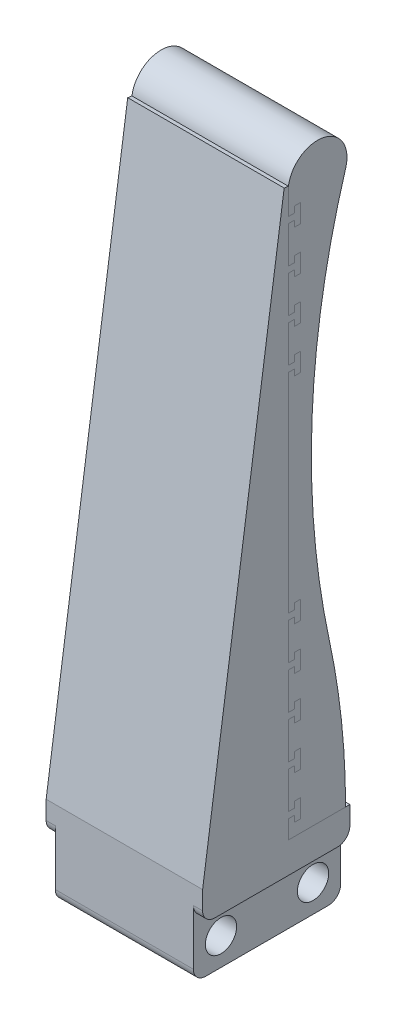
from build123d import *

# Parameters (mm, degrees)
THUMB_BASE_START        = -11.25
THUMB_BASE_OUTLINE_R    = 2.55
THUMB_BASE_DEPTH        = 22.5
THUMB_BASE_START_2      = -12.75
THUMB_BASE_2_DEPTH      = 25.5
THUMB_FRAME_DEPTH       = 25.5
CAVITY_PAD_DEPTH        = 115.636626674
PAD_HOOKS_DEPTH         = 25.5
SKETCH6_W               = 2.787046331
SKETCH6_H               = 25.802107577
CLEARANCE_PAD_CUT_DEPTH = 115.636626674
PAD_MATERIAL_DEPTH      = 25.5
WALL_REMOVAL_DEPTH      = 115.636626674


# Read off the part's stored shape, not the designer's step: thumb_base
with BuildPart() as part:
    # thumb_base outline → thumb_base (new body)
    with BuildSketch(Plane.YZ.offset(THUMB_BASE_START)):
        with BuildLine():
            Line((2, -12), (14, -12))
            Line((14, -12), (14, 12))
            Line((14, 12), (2, 12))
            ThreePointArc((2, 12), (0.585786438, 11.414213562), (0, 10))
            Line((0, 10), (0, -10))
            ThreePointArc((0, -10), (0.585786438, -11.414213562), (2, -12))
        make_face()
        with Locations((4.5, -7.5)):
            Circle(THUMB_BASE_OUTLINE_R, mode=Mode.SUBTRACT)
        with Locations((4.5, 7.5)):
            Circle(THUMB_BASE_OUTLINE_R, mode=Mode.SUBTRACT)
    extrude(amount=THUMB_BASE_DEPTH)

    # thumb_base 2 outline → thumb_base 2 (add)
    with BuildSketch(Plane.YZ.offset(THUMB_BASE_START_2)):
        with BuildLine():
            Line((9, 10), (9, -10))
            ThreePointArc((9, -10), (9.585786438, -11.414213562), (11, -12))
            Line((11, -12), (14, -12))
            Line((14, -12), (14, 12))
            Line((14, 12), (11, 12))
            ThreePointArc((11, 12), (9.585786438, 11.414213562), (9, 10))
        make_face()
    extrude(amount=THUMB_BASE_2_DEPTH)

    # Sketch3 → Thumb Frame (add)
    with BuildSketch(Plane(origin=(12.75, 0, 0), x_dir=(0, 0, -1), z_dir=(1, 0, 0))):
        with BuildLine():
            Line((-12, 14), (1.291731744, 106.37604253))
            ThreePointArc((1.291731744, 106.37604253), (7.927076457, 110.962137878), (12, 104))
            ThreePointArc((12, 104), (6.53842349, 71.669073962), (9.340066377, 39))
            ThreePointArc((9.340066377, 39), (11.333145203, 26.570553358), (12, 14))
            Line((12, 14), (-12, 14))
        make_face()
    extrude(amount=-THUMB_FRAME_DEPTH)

    # Sketch4 → Cavity - Pad (cut, through all)
    with BuildSketch(Plane(origin=(12.75, 0, 0), x_dir=(0, 0, -1), z_dir=(1, 0, 0))):
        with BuildLine():
            Line((1.984596118, 106.276348203), (1.984596118, 14))
            Line((1.984596118, 14), (11.3, 14))
            ThreePointArc((11.3, 14), (10.637074016, 26.496493232), (8.655737526, 38.852711086))
            ThreePointArc((8.655737526, 38.852711086), (5.83900887, 71.697695446), (11.329993869, 104.202711086))
            ThreePointArc((11.329993869, 104.202711086), (7.775442414, 110.278758688), (1.984596118, 106.276348203))
        make_face()
    extrude(amount=-CAVITY_PAD_DEPTH, mode=Mode.SUBTRACT)

    # Sketch5 → Pad Hooks (add)
    with BuildSketch(Plane(origin=(12.75, 0, 0), x_dir=(0, 0, -1), z_dir=(1, 0, 0))):
        Polygon((1.984596118, 17), (2.984596118, 17), (2.984596118, 16), (3.984596118, 16), (3.984596118, 19), (2.984596118, 19), (2.984596118, 18), (1.984596118, 18), align=None)
        Polygon((1.984596118, 24), (2.984596118, 24), (2.984596118, 23), (3.984596118, 23), (3.984596118, 26), (2.984596118, 26), (2.984596118, 25), (1.984596118, 25), align=None)
        Polygon((1.984596118, 31), (2.984596118, 31), (2.984596118, 30), (3.984596118, 30), (3.984596118, 33), (2.984596118, 33), (2.984596118, 32), (1.984596118, 32), align=None)
        Polygon((1.984596118, 38), (2.984596118, 38), (2.984596118, 37), (3.984596118, 37), (3.984596118, 40), (2.984596118, 40), (2.984596118, 39), (1.984596118, 39), align=None)
        Polygon((1.984596118, 45), (2.984596118, 45), (2.984596118, 44), (3.984596118, 44), (3.984596118, 47), (2.984596118, 47), (2.984596118, 46), (1.984596118, 46), align=None)
        Polygon((1.984596118, 52), (2.984596118, 52), (2.984596118, 51), (3.984596118, 51), (3.984596118, 54), (2.984596118, 54), (2.984596118, 53), (1.984596118, 53), align=None)
        Polygon((1.984596118, 59), (2.984596118, 59), (2.984596118, 58), (3.984596118, 58), (3.984596118, 61), (2.984596118, 61), (2.984596118, 60), (1.984596118, 60), align=None)
        Polygon((1.984596118, 66), (2.984596118, 66), (2.984596118, 65), (3.984596118, 65), (3.984596118, 68), (2.984596118, 68), (2.984596118, 67), (1.984596118, 67), align=None)
        Polygon((1.984596118, 73), (2.984596118, 73), (2.984596118, 72), (3.984596118, 72), (3.984596118, 75), (2.984596118, 75), (2.984596118, 74), (1.984596118, 74), align=None)
        Polygon((1.984596118, 80), (2.984596118, 80), (2.984596118, 79), (3.984596118, 79), (3.984596118, 82), (2.984596118, 82), (2.984596118, 81), (1.984596118, 81), align=None)
        Polygon((1.984596118, 87), (2.984596118, 87), (2.984596118, 86), (3.984596118, 86), (3.984596118, 89), (2.984596118, 89), (2.984596118, 88), (1.984596118, 88), align=None)
        Polygon((1.984596118, 94), (2.984596118, 94), (2.984596118, 93), (3.984596118, 93), (3.984596118, 96), (2.984596118, 96), (2.984596118, 95), (1.984596118, 95), align=None)
        Polygon((1.984596118, 101), (2.984596118, 101), (2.984596118, 100), (3.984596118, 100), (3.984596118, 103), (2.984596118, 103), (2.984596118, 102), (1.984596118, 102), align=None)
    extrude(amount=-PAD_HOOKS_DEPTH)

    # Sketch6 → Clearance - Pad Cut (cut, through all)
    with BuildSketch(Plane(origin=(12.75, 0, 0), x_dir=(0, 0, -1), z_dir=(1, 0, 0))):
        with Locations((3.378119284, 62.835394106)):
            Rectangle(SKETCH6_W, SKETCH6_H)
    extrude(amount=-CLEARANCE_PAD_CUT_DEPTH, mode=Mode.SUBTRACT)

    # Sketch8 → Wall Removal (cut, through all)
    with BuildSketch(Plane(origin=(12.75, 0, 0), x_dir=(0, 0, -1), z_dir=(1, 0, 0))):
        with BuildLine():
            Line((11.3, 14), (12, 14))
            ThreePointArc((12, 14), (11.333145203, 26.570553358), (9.340066377, 39))
            ThreePointArc((9.340066377, 39), (6.53842349, 71.669073962), (12, 104))
            ThreePointArc((12, 104), (7.927076457, 110.962137878), (1.291731744, 106.37604253))
            Line((1.291731744, 106.37604253), (1.984596118, 106.276348203))
            ThreePointArc((1.984596118, 106.276348203), (7.775442414, 110.278758688), (11.329993869, 104.202711086))
            ThreePointArc((11.329993869, 104.202711086), (5.83900887, 71.697695446), (8.655737526, 38.852711086))
            ThreePointArc((8.655737526, 38.852711086), (10.637074016, 26.496493232), (11.3, 14))
        make_face()
    extrude(amount=-WALL_REMOVAL_DEPTH, mode=Mode.SUBTRACT)


with BuildPart() as body_2:
    # Sketch7 → Pad Material (new body)
    with BuildSketch(Plane(origin=(12.75, 0, 0), x_dir=(0, 0, -1), z_dir=(1, 0, 0))):
        with BuildLine():
            Line((1.984596118, 80), (1.984596118, 46))
            Line((1.984596118, 46), (2.984596118, 46))
            Line((2.984596118, 46), (2.984596118, 47))
            Line((2.984596118, 47), (3.984596118, 47))
            Line((3.984596118, 47), (3.984596118, 44))
            Line((3.984596118, 44), (2.984596118, 44))
            Line((2.984596118, 44), (2.984596118, 45))
            Line((2.984596118, 45), (1.984596118, 45))
            Line((1.984596118, 45), (1.984596118, 39))
            Line((1.984596118, 39), (2.984596118, 39))
            Line((2.984596118, 39), (2.984596118, 40))
            Line((2.984596118, 40), (3.984596118, 40))
            Line((3.984596118, 40), (3.984596118, 37))
            Line((3.984596118, 37), (2.984596118, 37))
            Line((2.984596118, 37), (2.984596118, 38))
            Line((2.984596118, 38), (1.984596118, 38))
            Line((1.984596118, 38), (1.984596118, 32))
            Line((1.984596118, 32), (2.984596118, 32))
            Line((2.984596118, 32), (2.984596118, 33))
            Line((2.984596118, 33), (3.984596118, 33))
            Line((3.984596118, 33), (3.984596118, 30))
            Line((3.984596118, 30), (2.984596118, 30))
            Line((2.984596118, 30), (2.984596118, 31))
            Line((2.984596118, 31), (1.984596118, 31))
            Line((1.984596118, 31), (1.984596118, 25))
            Line((1.984596118, 25), (2.984596118, 25))
            Line((2.984596118, 25), (2.984596118, 26))
            Line((2.984596118, 26), (3.984596118, 26))
            Line((3.984596118, 26), (3.984596118, 23))
            Line((3.984596118, 23), (2.984596118, 23))
            Line((2.984596118, 23), (2.984596118, 24))
            Line((2.984596118, 24), (1.984596118, 24))
            Line((1.984596118, 24), (1.984596118, 18))
            Line((1.984596118, 18), (2.984596118, 18))
            Line((2.984596118, 18), (2.984596118, 19))
            Line((2.984596118, 19), (3.984596118, 19))
            Line((3.984596118, 19), (3.984596118, 16))
            Line((3.984596118, 16), (2.984596118, 16))
            Line((2.984596118, 16), (2.984596118, 17))
            Line((2.984596118, 17), (1.984596118, 17))
            Line((1.984596118, 17), (1.984596118, 14))
            Line((1.984596118, 14), (11.3, 14))
            ThreePointArc((11.3, 14), (10.637074016, 26.496493232), (8.655737526, 38.852711086))
            ThreePointArc((8.655737526, 38.852711086), (5.83900887, 71.697695446), (11.329993869, 104.202711086))
            ThreePointArc((11.329993869, 104.202711086), (7.775442414, 110.278758688), (1.984596118, 106.276348203))
            Line((1.984596118, 106.276348203), (1.984596118, 102))
            Line((1.984596118, 102), (2.984596118, 102))
            Line((2.984596118, 102), (2.984596118, 103))
            Line((2.984596118, 103), (3.984596118, 103))
            Line((3.984596118, 103), (3.984596118, 100))
            Line((3.984596118, 100), (2.984596118, 100))
            Line((2.984596118, 100), (2.984596118, 101))
            Line((2.984596118, 101), (1.984596118, 101))
            Line((1.984596118, 101), (1.984596118, 95))
            Line((1.984596118, 95), (2.984596118, 95))
            Line((2.984596118, 95), (2.984596118, 96))
            Line((2.984596118, 96), (3.984596118, 96))
            Line((3.984596118, 96), (3.984596118, 93))
            Line((3.984596118, 93), (2.984596118, 93))
            Line((2.984596118, 93), (2.984596118, 94))
            Line((2.984596118, 94), (1.984596118, 94))
            Line((1.984596118, 94), (1.984596118, 88))
            Line((1.984596118, 88), (2.984596118, 88))
            Line((2.984596118, 88), (2.984596118, 89))
            Line((2.984596118, 89), (3.984596118, 89))
            Line((3.984596118, 89), (3.984596118, 86))
            Line((3.984596118, 86), (2.984596118, 86))
            Line((2.984596118, 86), (2.984596118, 87))
            Line((2.984596118, 87), (1.984596118, 87))
            Line((1.984596118, 87), (1.984596118, 81))
            Line((1.984596118, 81), (2.984596118, 81))
            Line((2.984596118, 81), (2.984596118, 82))
            Line((2.984596118, 82), (3.984596118, 82))
            Line((3.984596118, 82), (3.984596118, 79))
            Line((3.984596118, 79), (2.984596118, 79))
            Line((2.984596118, 79), (2.984596118, 80))
            Line((2.984596118, 80), (1.984596118, 80))
        make_face()
    extrude(amount=-PAD_MATERIAL_DEPTH)


solid = Compound([part.part, body_2.part])
